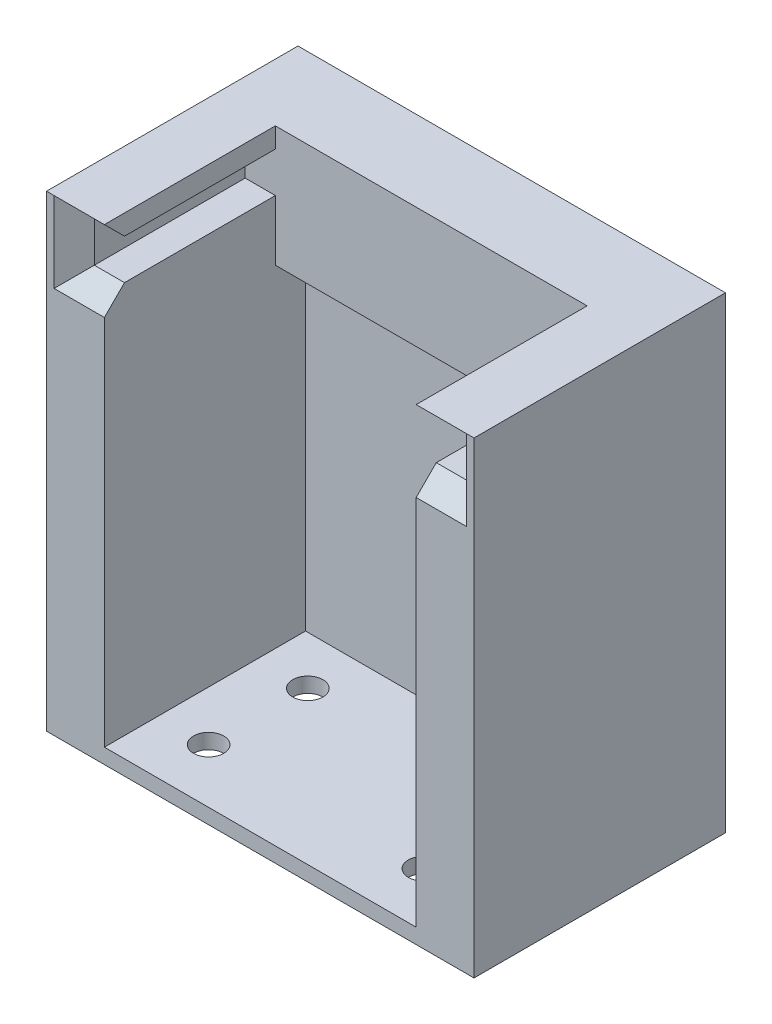
from build123d import *

# Parameters (mm, degrees)
SKETCH1_W           = 85
SKETCH1_H           = 50
BOSS_EXTRUDE1_DEPTH = 90
CUT_EXTRUDE1_REACH  = 135.51
SKETCH2_W           = 62
SKETCH2_H           = 40
SKETCH3_W           = 85
SKETCH3_H           = 16
BOSS_EXTRUDE2_DEPTH = 24
CUT_EXTRUDE2_REACH  = 130.378
SKETCH4_W           = 6
SKETCH4_H           = 8
SKETCH5_W           = 85
SKETCH5_H           = 50
BOSS_EXTRUDE3_DEPTH = 3
CUT_EXTRUDE3_REACH  = 135.51
SKETCH6_R           = 3
CHAMFER1_SIZE       = 4


with BuildPart() as part:
    # Sketch1 → Boss-Extrude1 (new body)
    with BuildSketch(Plane(origin=(0, 0, 0), x_dir=(1, 0, 0), z_dir=(0, 1, 0))):
        with Locations((-42.5, -25)):
            Rectangle(SKETCH1_W, SKETCH1_H)
    extrude(amount=BOSS_EXTRUDE1_DEPTH)

    # Sketch2 → Cut-Extrude1 (cut, up to next)
    with BuildSketch(Plane(origin=(0, 90, 0), x_dir=(1, 0, 0), z_dir=(0, 1, 0)), mode=Mode.PRIVATE) as cut_extrude1_sk1:
        with Locations((-42.5, -30)):
            Rectangle(SKETCH2_W, SKETCH2_H)
    cut_extrude1_tool1 = extrude(cut_extrude1_sk1.sketch, amount=-CUT_EXTRUDE1_REACH, mode=Mode.PRIVATE) & part.part
    add(cut_extrude1_tool1.solids().sort_by_distance((-42.5, 90, 30))[0], mode=Mode.SUBTRACT)

    # Sketch3 → Boss-Extrude2 (add)
    with BuildSketch(Plane(origin=(0, 90, 0), x_dir=(1, 0, 0), z_dir=(0, 1, 0))):
        with Locations((-42.5, -8)):
            Rectangle(SKETCH3_W, SKETCH3_H)
    extrude(amount=-BOSS_EXTRUDE2_DEPTH)

    # Sketch4 → Cut-Extrude2 (cut, up to next)
    with BuildSketch(Plane.XY.offset(16), mode=Mode.PRIVATE) as cut_extrude2_sk1:
        with Locations((-76.5, 82)):
            Rectangle(SKETCH4_W, SKETCH4_H)
    cut_extrude2_tool1 = extrude(cut_extrude2_sk1.sketch, amount=CUT_EXTRUDE2_REACH, mode=Mode.PRIVATE) & part.part
    # Sketch4 → Cut-Extrude2 (cut, up to next)
    with BuildSketch(Plane.XY.offset(16), mode=Mode.PRIVATE) as cut_extrude2_sk2:
        with Locations((-8.5, 82)):
            Rectangle(SKETCH4_W, SKETCH4_H)
    cut_extrude2_tool2 = extrude(cut_extrude2_sk2.sketch, amount=CUT_EXTRUDE2_REACH, mode=Mode.PRIVATE) & part.part
    add(cut_extrude2_tool1.solids().sort_by_distance((-76.5, 82, 16))[0], mode=Mode.SUBTRACT)
    add(cut_extrude2_tool2.solids().sort_by_distance((-8.5, 82, 16))[0], mode=Mode.SUBTRACT)

    # Sketch5 → Boss-Extrude3 (add)
    with BuildSketch(Plane.XZ):
        with Locations((-42.5, 25)):
            Rectangle(SKETCH5_W, SKETCH5_H)
    extrude(amount=BOSS_EXTRUDE3_DEPTH)

    # Sketch6 → Cut-Extrude3 (cut, up to next)
    with BuildSketch(Plane(origin=(0, 0, 0), x_dir=(1, 0, 0), z_dir=(0, 1, 0)), mode=Mode.PRIVATE) as cut_extrude3_sk1:
        with Locations(Location((-63.406474548, -19.640219105, 0), (0, 0, 270))):
            Circle(SKETCH6_R)
    cut_extrude3_tool1 = extrude(cut_extrude3_sk1.sketch, amount=-CUT_EXTRUDE3_REACH, mode=Mode.PRIVATE) & part.part
    # Sketch6 → Cut-Extrude3 (cut, up to next)
    with BuildSketch(Plane(origin=(0, 0, 0), x_dir=(1, 0, 0), z_dir=(0, 1, 0)), mode=Mode.PRIVATE) as cut_extrude3_sk2:
        with Locations(Location((-20.861133032, -19.640219105, 0), (0, 0, 270))):
            Circle(SKETCH6_R)
    cut_extrude3_tool2 = extrude(cut_extrude3_sk2.sketch, amount=-CUT_EXTRUDE3_REACH, mode=Mode.PRIVATE) & part.part
    # Sketch6 → Cut-Extrude3 (cut, up to next)
    with BuildSketch(Plane(origin=(0, 0, 0), x_dir=(1, 0, 0), z_dir=(0, 1, 0)), mode=Mode.PRIVATE) as cut_extrude3_sk3:
        with Locations(Location((-20.861133032, -39.202410137, 0), (0, 0, 270))):
            Circle(SKETCH6_R)
    cut_extrude3_tool3 = extrude(cut_extrude3_sk3.sketch, amount=-CUT_EXTRUDE3_REACH, mode=Mode.PRIVATE) & part.part
    # Sketch6 → Cut-Extrude3 (cut, up to next)
    with BuildSketch(Plane(origin=(0, 0, 0), x_dir=(1, 0, 0), z_dir=(0, 1, 0)), mode=Mode.PRIVATE) as cut_extrude3_sk4:
        with Locations(Location((-63.571834409, -39.202410137, 0), (0, 0, 270))):
            Circle(SKETCH6_R)
    cut_extrude3_tool4 = extrude(cut_extrude3_sk4.sketch, amount=-CUT_EXTRUDE3_REACH, mode=Mode.PRIVATE) & part.part
    add(cut_extrude3_tool1.solids().sort_by_distance((-63.406475, 0, 19.640219))[0], mode=Mode.SUBTRACT)
    add(cut_extrude3_tool2.solids().sort_by_distance((-20.861133, 0, 19.640219))[0], mode=Mode.SUBTRACT)
    add(cut_extrude3_tool3.solids().sort_by_distance((-20.861133, 0, 39.20241))[0], mode=Mode.SUBTRACT)
    add(cut_extrude3_tool4.solids().sort_by_distance((-63.571834, 0, 39.20241))[0], mode=Mode.SUBTRACT)

    # Chamfer1
    chamfer1_edges = [part.edges().sort_by_distance(p)[0] for p in [
        (-76.5, 86, 50),
        (-79.5, 82, 50),
        (-76.5, 78, 50),
        (-8.5, 78, 50),
        (-5.5, 82, 50),
        (-8.5, 86, 50),
    ]]
    chamfer(chamfer1_edges, length=CHAMFER1_SIZE - 0.0001)  # a hair under: the kernel refuses the full size


solid = part.part
